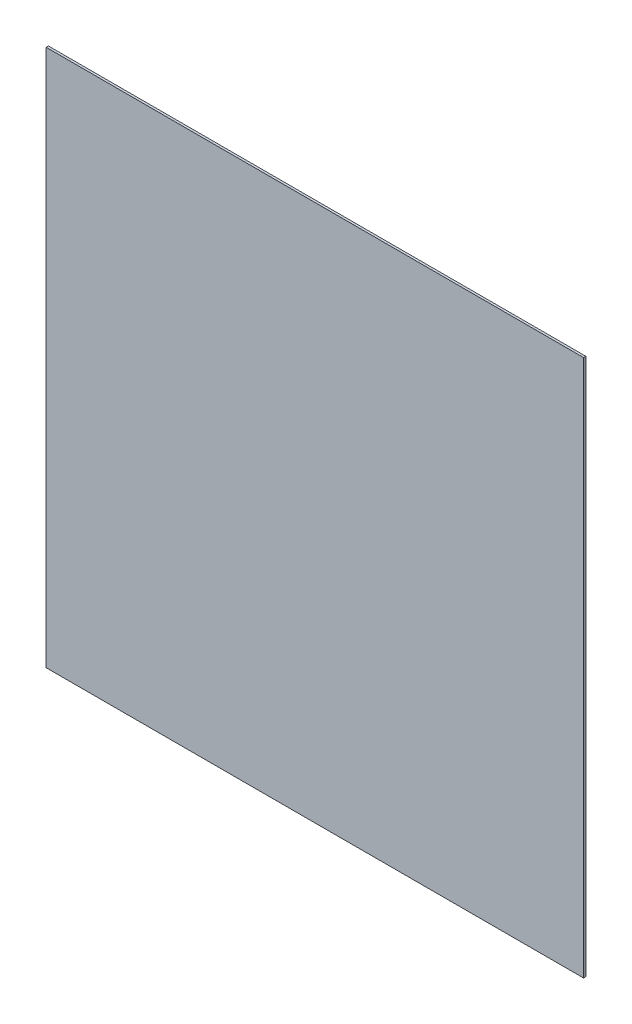
from build123d import *

# Parameters (mm, degrees)
SKETCH1_W           = 750
SKETCH1_H           = 750
BOSS_EXTRUDE1_DEPTH = 3.175


with BuildPart() as part:
    # Sketch1 → Boss-Extrude1 (new body)
    with BuildSketch(Plane.XY):
        Rectangle(SKETCH1_W, SKETCH1_H)
    extrude(amount=BOSS_EXTRUDE1_DEPTH)


solid = part.part
